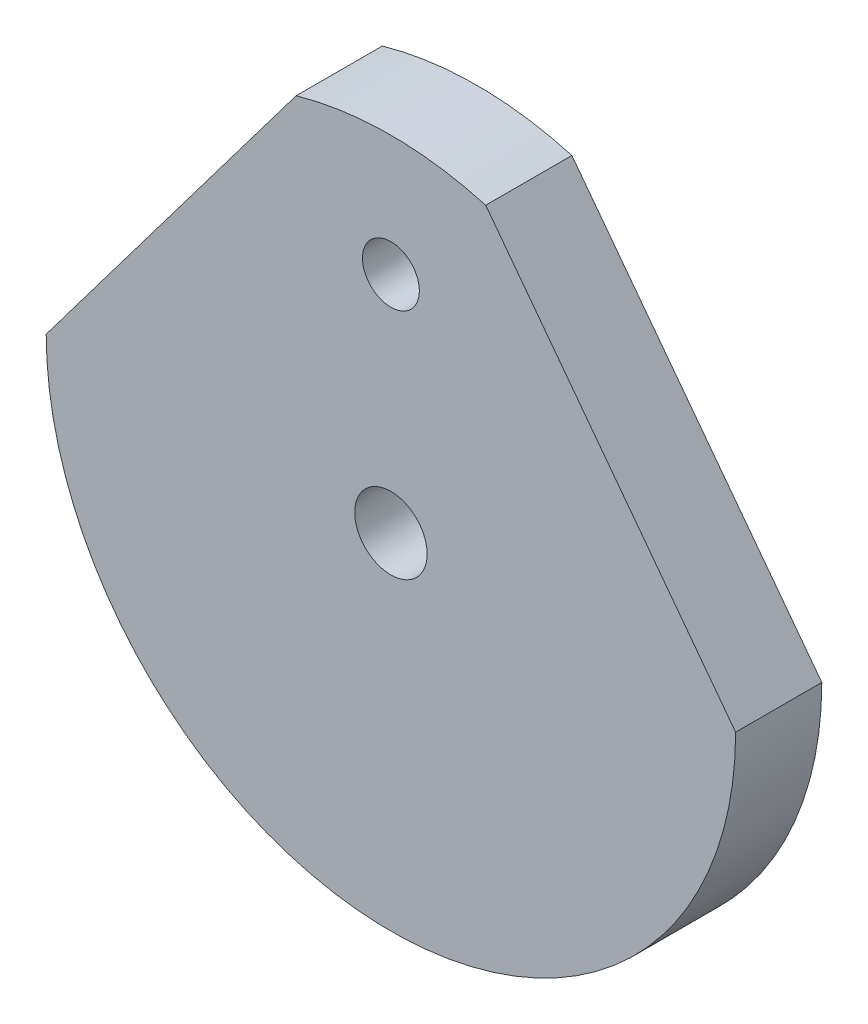
from build123d import *

# Parameters (mm, degrees)
BOSS_EXTRUDE1_DEPTH = 2.5
SKETCH2_R           = 5
BOSS_EXTRUDE2_DEPTH = 1
FILLET1_R           = 1
M5_TAPPED_HOLE1_D   = 4.2
M4_TAPPED_HOLE1_D   = 3.3


with BuildPart() as part:
    # Sketch1 → Boss-Extrude1 (new, symmetric)
    with BuildSketch(Plane.XY):
        with BuildLine():
            Line((-5.5, 19.228884523), (-20, 0))
            ThreePointArc((-20, 0), (0, -20), (20, 0))
            Line((20, 0), (5.5, 19.228884523))
            ThreePointArc((5.5, 19.228884523), (0, 20), (-5.5, 19.228884523))
        make_face()
    extrude(amount=BOSS_EXTRUDE1_DEPTH, both=True)

    # Sketch2 → Boss-Extrude2 (add)
    with BuildSketch(Plane(origin=(0, 0, -2.5), x_dir=(-1, 0, 0), z_dir=(0, 0, -1))):
        Circle(SKETCH2_R)
    extrude(amount=BOSS_EXTRUDE2_DEPTH)

    # Fillet1
    fillet1_edges = [part.edges().sort_by_distance(p)[0] for p in [
        (5, 0, -2.5),
    ]]
    fillet(fillet1_edges, radius=FILLET1_R - 0.0001)  # a hair under: the kernel refuses the full size

    # M5 Tapped Hole1 (through all)
    with Locations(Plane.XY.offset(2.5)):
        with Locations((0, 0)):
            Hole(M5_TAPPED_HOLE1_D / 2)

    # M4 Tapped Hole1 (through all)
    with Locations(Plane(origin=(0, 13, 2.5), x_dir=(1, 0, 0), z_dir=(0, 0, 1))):
        with Locations((0, 0)):
            Hole(M4_TAPPED_HOLE1_D / 2)


solid = part.part
